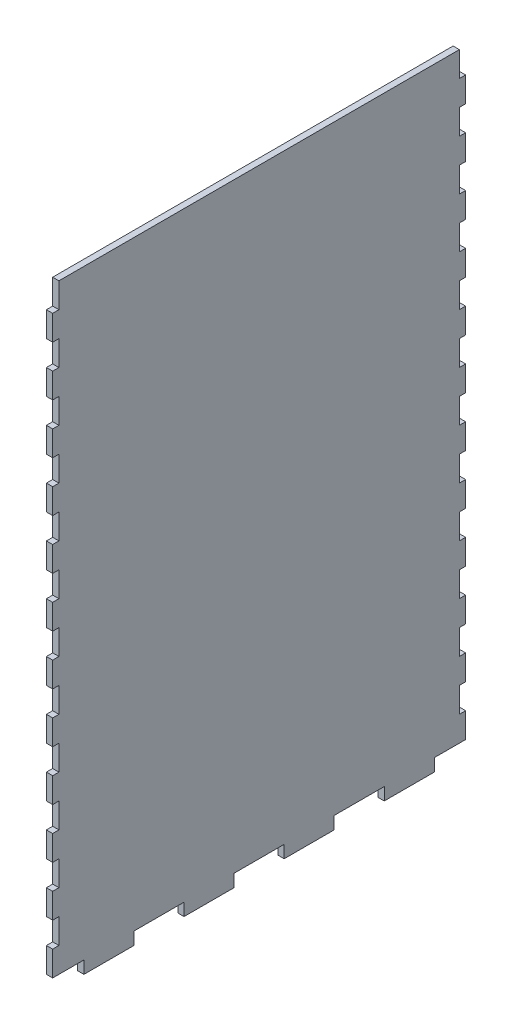
from build123d import *

# Parameters (mm, degrees)
BOSS_EXTRUDE1_DEPTH = 3.175


with BuildPart() as part:
    # Sketch1 → Boss-Extrude1 (new body)
    with BuildSketch(Plane(origin=(0, 0, 0), x_dir=(0, 0, -1), z_dir=(1, 0, 0))):
        Polygon((0, 25.4), (0, 12.7), (-3.175, 12.7), (-3.175, 0), (12.7, 0), (12.7, -6.35), (38.1, -6.35), (38.1, 0), (63.5, 0), (63.5, -6.35), (88.9, -6.35), (88.9, 0), (114.3, 0), (114.3, -6.35), (139.7, -6.35), (139.7, 0), (165.1, 0), (165.1, -6.35), (190.5, -6.35), (190.5, 0), (206.375, 0), (206.375, 12.7), (203.2, 12.7), (203.2, 25.4), (206.375, 25.4), (206.375, 38.1), (203.2, 38.1), (203.2, 50.8), (206.375, 50.8), (206.375, 63.5), (203.2, 63.5), (203.2, 76.2), (206.375, 76.2), (206.375, 88.9), (203.2, 88.9), (203.2, 101.6), (206.375, 101.6), (206.375, 114.3), (203.2, 114.3), (203.2, 127), (206.375, 127), (206.375, 139.7), (203.2, 139.7), (203.2, 152.4), (206.375, 152.4), (206.375, 165.1), (203.2, 165.1), (203.2, 177.8), (206.375, 177.8), (206.375, 190.5), (203.2, 190.5), (203.2, 203.2), (206.375, 203.2), (206.375, 215.9), (203.2, 215.9), (203.2, 228.6), (206.375, 228.6), (206.375, 241.3), (203.2, 241.3), (203.2, 254), (206.375, 254), (206.375, 266.7), (203.2, 266.7), (203.2, 279.4), (206.375, 279.4), (206.375, 292.1), (203.2, 292.1), (203.2, 304.8), (0, 304.8), (0, 292.1), (-3.175, 292.1), (-3.175, 279.4), (0, 279.4), (0, 266.7), (-3.175, 266.7), (-3.175, 254), (0, 254), (0, 241.3), (-3.175, 241.3), (-3.175, 228.6), (0, 228.6), (0, 215.9), (-3.175, 215.9), (-3.175, 203.2), (0, 203.2), (0, 190.5), (-3.175, 190.5), (-3.175, 177.8), (0, 177.8), (0, 165.1), (-3.175, 165.1), (-3.175, 152.4), (0, 152.4), (0, 139.7), (-3.175, 139.7), (-3.175, 127), (0, 127), (0, 114.3), (-3.175, 114.3), (-3.175, 101.6), (0, 101.6), (0, 88.9), (-3.175, 88.9), (-3.175, 76.2), (0, 76.2), (0, 63.5), (-3.175, 63.5), (-3.175, 50.8), (0, 50.8), (0, 38.1), (-3.175, 38.1), (-3.175, 25.4), align=None)
    extrude(amount=BOSS_EXTRUDE1_DEPTH)


solid = part.part
